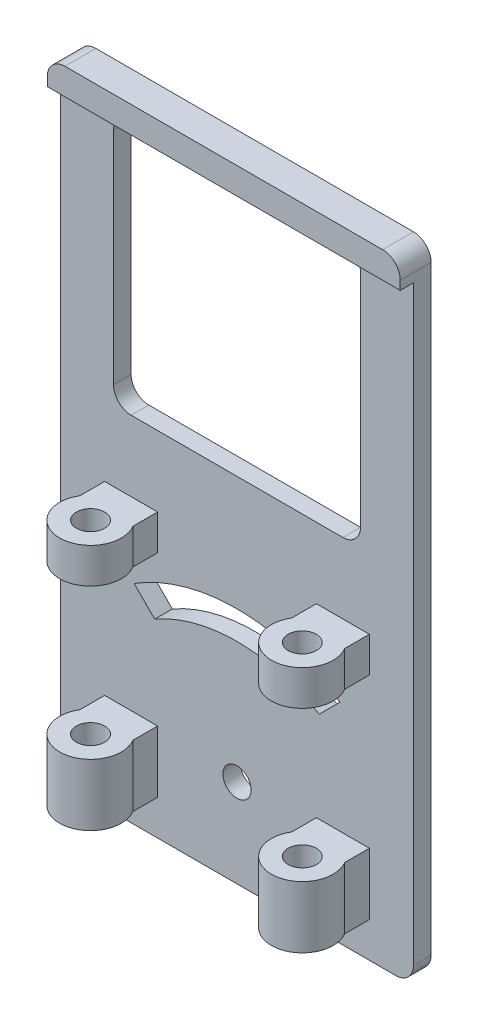
from build123d import *
from build123d.topology import SkipClean

# Parameters (mm, degrees)
SKETCH1_W                                    = 40
SKETCH1_H                                    = 40
BOSS_EXTRUDE2_DEPTH                          = 2
SKETCH2_W                                    = 6
SKETCH2_H                                    = 4
BOSS_EXTRUDE5_DEPTH                          = 3
SKETCH4_R                                    = 3.5
SKETCH4_R_2                                  = 1.6
BOSS_EXTRUDE6_DEPTH                          = 4
MIRROR2_AT_THE_SECOND_PLANE_COPY_1_SKETC_W   = 6
MIRROR2_AT_THE_SECOND_PLANE_COPY_1_SKETC_H   = 4
MIRROR2_AT_THE_SECOND_PLANE_COPY_1_DEPTH     = 3
MIRROR2_AT_THE_SECOND_PLANE_COPY_2_SKETC_R   = 3.5
MIRROR2_AT_THE_SECOND_PLANE_COPY_2_SKETC_R_2 = 1.6
MIRROR2_AT_THE_SECOND_PLANE_COPY_2_DEPTH     = 4
CUT_EXTRUDE2_DEPTH                           = 2
SKETCH8_R                                    = 1.6
CUT_EXTRUDE3_DEPTH                           = 2
SKETCH18_W                                   = 6
SKETCH18_H                                   = 2
BOSS_EXTRUDE10_DEPTH                         = 32
SKETCH19_W                                   = 40
SKETCH19_H                                   = 3.5
BOSS_EXTRUDE11_DEPTH                         = 3
FILLET1_R                                    = 2
SKETCH20_R                                   = 1.6
BOSS_EXTRUDE12_DEPTH                         = 10
SKETCH22_R                                   = 1.6
CUT_EXTRUDE4_DEPTH                           = 7


with BuildPart() as part:
    # Sketch1 → Boss-Extrude2 (new body)
    with BuildSketch(Plane.XY):
        Rectangle(SKETCH1_W, SKETCH1_H)
    extrude(amount=BOSS_EXTRUDE2_DEPTH)

    # Sketch2 → Boss-Extrude5 (add)
    with BuildSketch(Plane.XY.offset(2)):
        with Locations((-12, 10)):
            Rectangle(SKETCH2_W, SKETCH2_H)
    boss_extrude5 = extrude(amount=BOSS_EXTRUDE5_DEPTH)

    # Sketch4 → Boss-Extrude6 (add)
    with BuildSketch(Plane(origin=(0, 12, 0), x_dir=(1, 0, 0), z_dir=(0, 1, 0))):
        with Locations((-12, -6.6)):
            Circle(SKETCH4_R)
        with Locations((-12, -6.6)):
            Circle(SKETCH4_R_2, mode=Mode.SUBTRACT)
    boss_extrude6 = extrude(amount=-BOSS_EXTRUDE6_DEPTH)

    # Mirror2: Boss-Extrude5, Boss-Extrude6 across plane
    add(boss_extrude5.mirror(Plane(origin=(0, 0, 0), x_dir=(0, 0, 1), z_dir=(1, 0, 0))))
    add(boss_extrude6.mirror(Plane(origin=(0, 0, 0), x_dir=(0, 0, 1), z_dir=(1, 0, 0))))

    # Mirror2 at the second plane: Boss-Extrude5, Boss-Extrude6 across plane
    add(boss_extrude5.mirror(Plane(origin=(0, 3, 0), x_dir=(0, 0, 1), z_dir=(0, -1, 0))))
    add(boss_extrude6.mirror(Plane(origin=(0, 3, 0), x_dir=(0, 0, 1), z_dir=(0, -1, 0))))

    # Mirror2 at the second plane copy 1 sketc → Mirror2 at the second plane copy 1 (add)
    with BuildSketch(Plane(origin=(0, 6, 2), x_dir=(-1, 0, 0), z_dir=(0, 0, 1))):
        with Locations((-12, 10)):
            Rectangle(MIRROR2_AT_THE_SECOND_PLANE_COPY_1_SKETC_W, MIRROR2_AT_THE_SECOND_PLANE_COPY_1_SKETC_H)
    extrude(amount=MIRROR2_AT_THE_SECOND_PLANE_COPY_1_DEPTH)

    # Mirror2 at the second plane copy 2 sketc → Mirror2 at the second plane copy 2 (add)
    with BuildSketch(Plane(origin=(0, -6, 0), x_dir=(-1, 0, 0), z_dir=(0, -1, 0))):
        with Locations((-12, -6.6)):
            Circle(MIRROR2_AT_THE_SECOND_PLANE_COPY_2_SKETC_R)
        with Locations((-12, -6.6)):
            Circle(MIRROR2_AT_THE_SECOND_PLANE_COPY_2_SKETC_R_2, mode=Mode.SUBTRACT)
    extrude(amount=-MIRROR2_AT_THE_SECOND_PLANE_COPY_2_DEPTH)

    # Sketch7 → Cut-Extrude2 (cut)
    with BuildSketch(Plane.XY.offset(2)):
        with BuildLine():
            ThreePointArc((-9.324585763, 1.324585763), (0, 3.8), (9.324585763, 1.324585763))
            Line((9.324585763, 1.324585763), (11.657506391, 3.657506391))
            ThreePointArc((11.657506391, 3.657506391), (0, 7), (-11.657506391, 3.657506391))
            Line((-11.657506391, 3.657506391), (-9.324585763, 1.324585763))
        make_face()
    extrude(amount=-CUT_EXTRUDE2_DEPTH, mode=Mode.SUBTRACT)

    # Sketch8 → Cut-Extrude3 (cut)
    with BuildSketch(Plane(origin=(0, 0, 0), x_dir=(-1, 0, 0), z_dir=(0, 0, -1))):
        with Locations((0, -10)):
            Circle(SKETCH8_R)
    extrude(amount=-CUT_EXTRUDE3_DEPTH, mode=Mode.SUBTRACT)

    # Sketch18 → Boss-Extrude10 (add)
    with BuildSketch(Plane(origin=(0, 20, 0), x_dir=(1, 0, 0), z_dir=(0, 1, 0))):
        with Locations((17, -1)):
            Rectangle(SKETCH18_W, SKETCH18_H)
        with Locations((-17, -1)):
            Rectangle(SKETCH18_W, SKETCH18_H)
    extrude(amount=BOSS_EXTRUDE10_DEPTH)

    # Sketch19 → Boss-Extrude11 (add)
    with BuildSketch(Plane(origin=(0, 52, 0), x_dir=(1, 0, 0), z_dir=(0, 1, 0))):
        with Locations((0, -1.75)):
            Rectangle(SKETCH19_W, SKETCH19_H)
    extrude(amount=-BOSS_EXTRUDE11_DEPTH)

    # Fillet1
    fillet1_edges = [part.edges().sort_by_distance(p)[0] for p in [
        (20, -20, 1),
        (-20, -20, 1),
        (-20, 52, 1.75),
        (20, 52, 1.75),
        (14, 20, 1),
        (-14, 20, 1),
        (-14, 49, 1),
        (14, 49, 1),
    ]]
    fillet(fillet1_edges, radius=FILLET1_R)

    # Sketch20 → Boss-Extrude12 (add)
    # profile 1 of 2: a face of its own
    with SkipClean():  # the faces are left unmerged after this step: merging them gives an invalid solid
        with BuildSketch(Plane.XZ.offset(6)):
            with BuildLine():
                Line((-9, 2), (-9, 4.797224362))
                ThreePointArc((-9, 4.797224362), (-12, 10.1), (-15, 4.797224362))
                Line((-15, 4.797224362), (-15, 2))
                Line((-15, 2), (-9, 2))
            make_face()
            with Locations((-12, 6.6)):
                Circle(SKETCH20_R, mode=Mode.SUBTRACT)
        # profile 2 of 2: a face of its own
        with BuildSketch(Plane.XZ.offset(6)):
            with BuildLine():
                Line((9, 4.797224362), (9, 2))
                Line((9, 2), (15, 2))
                Line((15, 2), (15, 4.797224362))
                ThreePointArc((15, 4.797224362), (12, 10.1), (9, 4.797224362))
            make_face()
            with Locations((12, 6.6)):
                Circle(SKETCH20_R, mode=Mode.SUBTRACT)
        extrude(amount=BOSS_EXTRUDE12_DEPTH)

    # Sketch22 → Cut-Extrude4 (cut)
    # profile 1 of 2: a face of its own
    with BuildSketch(Plane(origin=(0, -2, 0), x_dir=(1, 0, 0), z_dir=(0, 1, 0))):
        with BuildLine():
            Line((9, -2), (9, -4.797224362))
            ThreePointArc((9, -4.797224362), (12, -10.1), (15, -4.797224362))
            Line((15, -4.797224362), (15, -2))
            Line((15, -2), (9, -2))
        make_face()
        with Locations((12, -6.6)):
            Circle(SKETCH22_R, mode=Mode.SUBTRACT)
    # profile 2 of 2: a face of its own
    with BuildSketch(Plane(origin=(0, -2, 0), x_dir=(1, 0, 0), z_dir=(0, 1, 0))):
        with BuildLine():
            Line((-9, -4.797224362), (-9, -2))
            Line((-9, -2), (-15, -2))
            Line((-15, -2), (-15, -4.797224362))
            ThreePointArc((-15, -4.797224362), (-12, -10.1), (-9, -4.797224362))
        make_face()
        with Locations((-12, -6.6)):
            Circle(SKETCH22_R, mode=Mode.SUBTRACT)
    extrude(amount=-CUT_EXTRUDE4_DEPTH, mode=Mode.SUBTRACT)


solid = part.part
